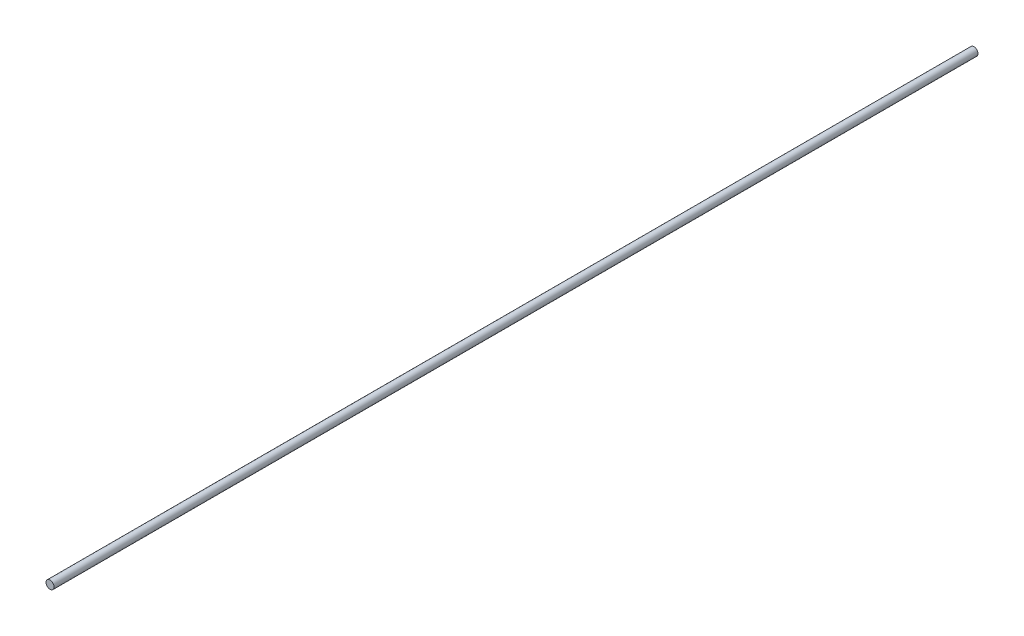
from build123d import *

# Parameters (mm, degrees)
SKETCH1_R           = 7.9375
BOSS_EXTRUDE1_DEPTH = 2254.25
SKETCH2_R           = 7.9375
CUT_EXTRUDE1_DEPTH  = 438.15


with BuildPart() as part:
    # Sketch1 → Boss-Extrude1 (new body)
    with BuildSketch(Plane.XY):
        Circle(SKETCH1_R)
    extrude(amount=BOSS_EXTRUDE1_DEPTH)

    # Sketch2 → Cut-Extrude1 (cut)
    with BuildSketch(Plane(origin=(0, 0, 0), x_dir=(-1, 0, 0), z_dir=(0, 0, -1))):
        Circle(SKETCH2_R)
    extrude(amount=-CUT_EXTRUDE1_DEPTH, mode=Mode.SUBTRACT)


solid = part.part
